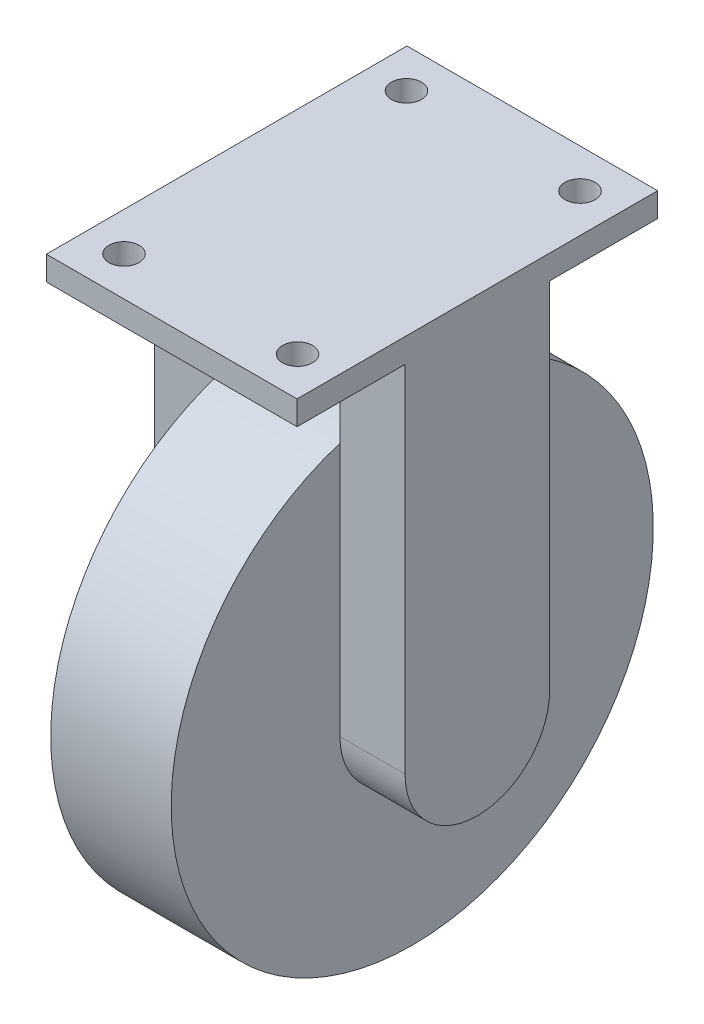
from build123d import *

# Parameters (mm, degrees)
SKETCH1_R           = 63.5
BOSS_EXTRUDE1_DEPTH = 15.875
BOSS_EXTRUDE2_START = 93.472
SKETCH2_W           = 66.04
SKETCH2_H           = 94.996
SKETCH2_R           = 3.96875
BOSS_EXTRUDE2_DEPTH = 6.35
SKETCH3_W           = 17.145
SKETCH3_H           = 38.1
BOSS_EXTRUDE3_DEPTH = 112.522
FILLET1_R           = 19.05


with BuildPart() as part:
    # Sketch1 → Boss-Extrude1 (new, symmetric)
    with BuildSketch(Plane(origin=(0, 0, 0), x_dir=(0, 0, -1), z_dir=(1, 0, 0))):
        Circle(SKETCH1_R)
    extrude(amount=BOSS_EXTRUDE1_DEPTH, both=True)



with BuildPart() as body_2:
    # Sketch2 → Boss-Extrude2 (new body)
    with BuildSketch(Plane(origin=(0, 0, 0), x_dir=(1, 0, 0), z_dir=(0, 1, 0)).offset(BOSS_EXTRUDE2_START)):
        Rectangle(SKETCH2_W, SKETCH2_H)
        with Locations(Location((-22.86, 37.211, 0), (0, 0, 270))):
            Circle(SKETCH2_R, mode=Mode.SUBTRACT)
        with Locations(Location((22.86, 37.211, 0), (0, 0, 270))):
            Circle(SKETCH2_R, mode=Mode.SUBTRACT)
        with Locations(Location((22.86, -37.211, 0), (0, 0, 270))):
            Circle(SKETCH2_R, mode=Mode.SUBTRACT)
        with Locations(Location((-22.86, -37.211, 0), (0, 0, 270))):
            Circle(SKETCH2_R, mode=Mode.SUBTRACT)
    extrude(amount=-BOSS_EXTRUDE2_DEPTH)


with BuildPart() as part_1:
    add(part.part)

    add(body_2.part)  # Boss-Extrude3 merges body 2
    # Sketch3 → Boss-Extrude3 (add)
    with BuildSketch(Plane.XZ.offset(-87.122)):
        with Locations((-24.4475, 0)):
            Rectangle(SKETCH3_W, SKETCH3_H)
        with Locations((24.4475, 0)):
            Rectangle(SKETCH3_W, SKETCH3_H)
    extrude(amount=BOSS_EXTRUDE3_DEPTH)

    # Fillet1
    fillet1_edges = [part_1.edges().sort_by_distance(p)[0] for p in [
        (-24.4475, -25.4, -19.05),
        (-24.4475, -25.4, 19.05),
        (24.4475, -25.4, 19.05),
        (24.4475, -25.4, -19.05),
    ]]
    fillet(fillet1_edges, radius=FILLET1_R - 0.0001)  # a hair under: the kernel refuses the full size


solid = part_1.part
